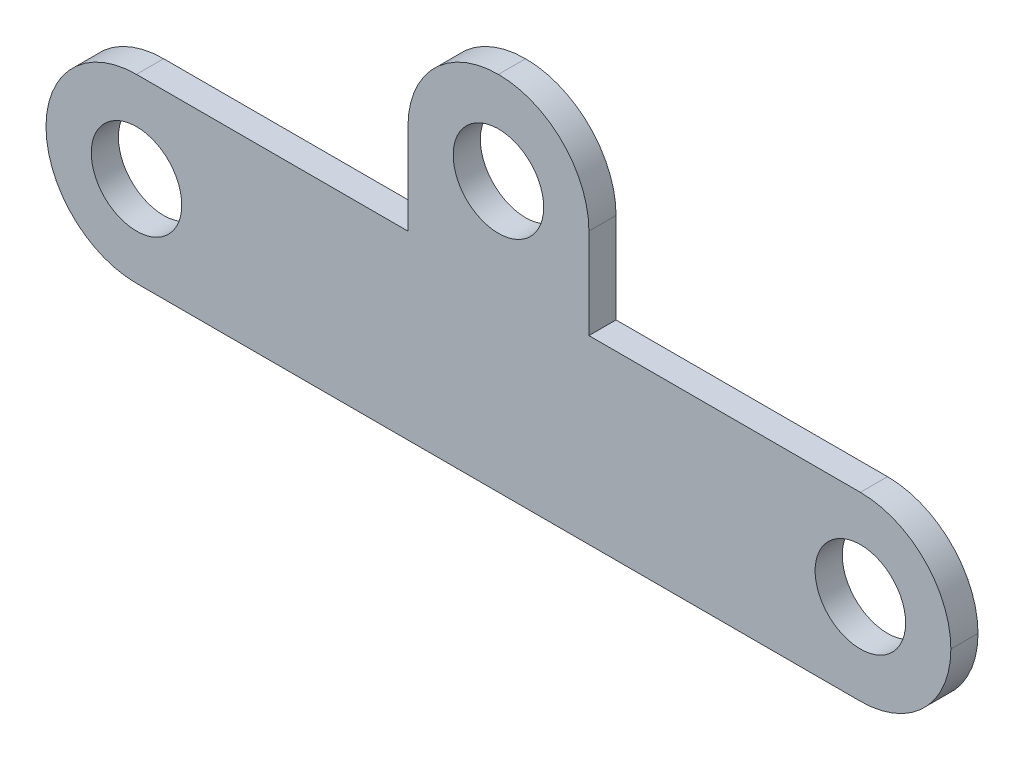
from build123d import *

# Parameters (mm, degrees)
SKETCH_1_W          = 100
SKETCH_1_H          = 20
EXTRUDE_1_DEPTH     = 3
FILLET_1_R          = 10
SKETCH_4_W          = 20
SKETCH_4_H          = 3
EXTRUDE_2_DEPTH     = 20
FILLET_2_R          = 10
SKETCH_5_R          = 5
CUT_EXTRUDE_1_DEPTH = 10
SKETCH_5_3_R        = 5
CUT_EXTRUDE_2_DEPTH = 10


with BuildPart() as part:
    # ｽｹｯﾁ1 → ﾎﾞｽ - 押し出し1 (new body)
    with BuildSketch(Plane.XY):
        with Locations((50, 10)):
            Rectangle(SKETCH_1_W, SKETCH_1_H)
    extrude(amount=EXTRUDE_1_DEPTH)

    # ﾌｨﾚｯﾄ1
    fillet_1_edges = [part.edges().sort_by_distance(p)[0] for p in [
        (100, 0, 1.5),
        (100, 20, 1.5),
        (0, 0, 1.5),
        (0, 20, 1.5),
    ]]
    fillet(fillet_1_edges, radius=FILLET_1_R - 0.0001)  # a hair under: the kernel refuses the full size

    # ｽｹｯﾁ4 → ﾎﾞｽ - 押し出し2 (add)
    with BuildSketch(Plane(origin=(0, 20, 0), x_dir=(1, 0, 0), z_dir=(0, 1, 0))):
        with Locations((50, -1.5)):
            Rectangle(SKETCH_4_W, SKETCH_4_H)
    extrude(amount=EXTRUDE_2_DEPTH)

    # ﾌｨﾚｯﾄ2
    fillet_2_edges = [part.edges().sort_by_distance(p)[0] for p in [
        (40, 40, 1.5),
        (60, 40, 1.5),
    ]]
    fillet(fillet_2_edges, radius=FILLET_2_R - 0.0001)  # a hair under: the kernel refuses the full size

    # ｽｹｯﾁ5 → ｶｯﾄ - 押し出し1 (cut)
    with BuildSketch(Plane.XY.offset(3)):
        with Locations((10, 10)):
            Circle(SKETCH_5_R)
    extrude(amount=-CUT_EXTRUDE_1_DEPTH, mode=Mode.SUBTRACT)

    # ｽｹｯﾁ5<3> → ｶｯﾄ - 押し出し2 (cut)
    with BuildSketch(Plane.XY.offset(3)):
        with Locations((50, 29.784394475)):
            Circle(SKETCH_5_3_R)
        with Locations((10, 10)):
            Circle(SKETCH_5_3_R)
        with Locations((90, 10)):
            Circle(SKETCH_5_3_R)
    extrude(amount=-CUT_EXTRUDE_2_DEPTH, mode=Mode.SUBTRACT)


solid = part.part
